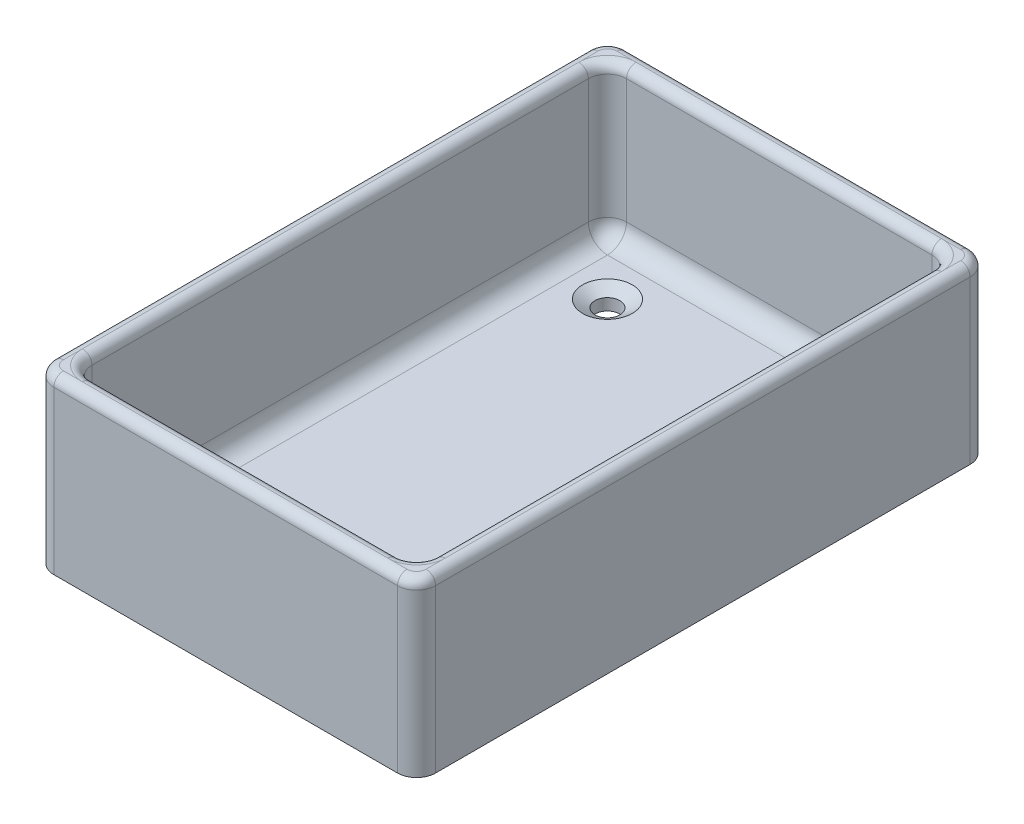
from build123d import *

# Parameters (mm, degrees)
SKETCH1_W           = 63.5
SKETCH1_H           = 95.25
SKETCH1_W_2         = 57.15
SKETCH1_H_2         = 88.9
EXTRUDE_THIN1_DEPTH = 25.4
FILLET1_R           = 3.175
BOSS_EXTRUDE1_DEPTH = 3.175
FILLET2_R           = 3.175
SKETCH3_R           = 2.06375
CUT_EXTRUDE1_DEPTH  = 3.175
CIRPATTERN1_COUNT   = 2
FILLET3_R           = 1.5875


with BuildPart() as part:
    # Sketch1 → Extrude-Thin1 (new body)
    with BuildSketch(Plane(origin=(0, 0, 0), x_dir=(1, 0, 0), z_dir=(0, 1, 0))):
        Rectangle(SKETCH1_W, SKETCH1_H)
        Rectangle(SKETCH1_W_2, SKETCH1_H_2, mode=Mode.SUBTRACT)
    extrude(amount=EXTRUDE_THIN1_DEPTH)

    # Fillet1
    fillet1_edges = [part.edges().sort_by_distance(p)[0] for p in [
        (28.575, 12.7, 44.45),
        (28.575, 12.7, -44.45),
        (-28.575, 12.7, -44.45),
        (-28.575, 12.7, 44.45),
        (31.75, 12.7, 47.625),
        (-31.75, 12.7, 47.625),
        (-31.75, 12.7, -47.625),
        (31.75, 12.7, -47.625),
    ]]
    fillet(fillet1_edges, radius=FILLET1_R)

    # Sketch2 → Boss-Extrude1 (add)
    with BuildSketch(Plane.XZ):
        with BuildLine():
            Line((31.75, -44.45), (31.75, 44.45))
            ThreePointArc((31.75, 44.45), (30.82006403, 46.69506403), (28.575, 47.625))
            Line((28.575, 47.625), (-28.575, 47.625))
            ThreePointArc((-28.575, 47.625), (-30.82006403, 46.69506403), (-31.75, 44.45))
            Line((-31.75, 44.45), (-31.75, -44.45))
            ThreePointArc((-31.75, -44.45), (-30.82006403, -46.69506403), (-28.575, -47.625))
            Line((-28.575, -47.625), (28.575, -47.625))
            ThreePointArc((28.575, -47.625), (30.82006403, -46.69506403), (31.75, -44.45))
        make_face()
    extrude(amount=BOSS_EXTRUDE1_DEPTH)

    # Fillet2
    fillet2_edges = [part.edges().sort_by_distance(p)[0] for p in [
        (28.575, 0, 0),
        (0, 0, -44.45),
        (-28.575, 0, 0),
        (0, 0, 44.45),
        (-27.64506403, 0, 43.52006403),
        (27.64506403, 0, 43.52006403),
        (27.64506403, 0, -43.52006403),
        (-27.64506403, 0, -43.52006403),
    ]]
    fillet(fillet2_edges, radius=FILLET2_R)

    # Sketch3 → Cut-Extrude1 (cut)
    with BuildSketch(Plane(origin=(0, 0, 0), x_dir=(1, 0, 0), z_dir=(0, 1, 0))):
        with Locations(Location((-19.05, 34.925, 0), (0, 0, 270))):
            Circle(SKETCH3_R)
    cut_extrude1 = extrude(amount=-CUT_EXTRUDE1_DEPTH, mode=Mode.SUBTRACT)

    # Sketch4 → Cut-Revolve1 (revolve, cut)
    with BuildSketch(Plane.YX.offset(34.925), mode=Mode.PRIVATE) as cut_revolve1_sk:
        Polygon((-2.480052205, -19.05), (0, -14.9225), (0, -19.05), align=None)
    cut_revolve1 = revolve(cut_revolve1_sk.sketch.rotate(Axis((-19.05, 0, -34.925), (0, -1, 0)), 90), axis=Axis((-19.05, 0, -34.925), (0, -1, 0)), mode=Mode.SUBTRACT)

    # CirPattern1: Cut-Extrude1, Cut-Revolve1 ×2 about axis
    cirpattern1_axis = Axis((0, 0, 0), (0, 1, 0))
    add([cut_extrude1.rotate(cirpattern1_axis, i * 360 / CIRPATTERN1_COUNT) for i in range(1, CIRPATTERN1_COUNT)], mode=Mode.SUBTRACT)
    add([cut_revolve1.rotate(cirpattern1_axis, i * 360 / CIRPATTERN1_COUNT) for i in range(1, CIRPATTERN1_COUNT)], mode=Mode.SUBTRACT)

    # Fillet3
    fillet3_edges = [part.edges().sort_by_distance(p)[0] for p in [
        (31.75, 25.4, 0),
        (0, 25.4, 47.625),
        (0, 25.4, -47.625),
        (-31.75, 25.4, 0),
        (0, 25.4, -44.45),
        (28.575, 25.4, 0),
        (0, 25.4, 44.45),
        (-28.575, 25.4, 0),
        (-30.82006403, 25.4, 46.69506403),
        (30.82006403, 25.4, -46.69506403),
        (-30.82006403, 25.4, -46.69506403),
        (30.82006403, 25.4, 46.69506403),
        (-27.64506403, 25.4, 43.52006403),
        (27.64506403, 25.4, 43.52006403),
        (27.64506403, 25.4, -43.52006403),
        (-27.64506403, 25.4, -43.52006403),
    ]]
    fillet(fillet3_edges, radius=FILLET3_R - 0.0001)  # a hair under: the kernel refuses the full size


solid = part.part
